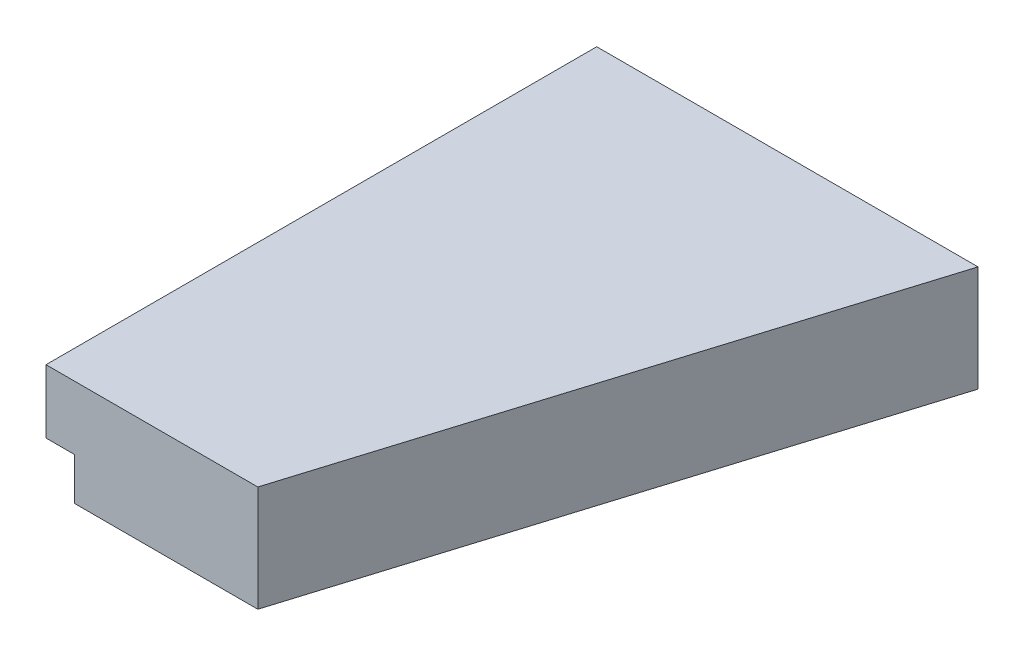
from build123d import *

# Parameters (mm, degrees)
BOSS_EXTRUDE1_DEPTH = 25
BOSS_EXTRUDE2_DEPTH = 10
SKETCH3_W           = 26.114253455
SKETCH3_H           = 3.5
CUT_EXTRUDE1_DEPTH  = 10
CUT_EXTRUDE2_DEPTH  = 0.625
CUT_EXTRUDE3_REACH  = 150.701
SKETCH5_R           = 1.9
SKETCH6_R           = 3.35
CUT_EXTRUDE4_DEPTH  = 2.5
LPATTERN1_COUNT     = 2
LPATTERN1_PITCH     = 52.5
SKETCH7_W           = 6.75
SKETCH7_H           = 130
CUT_EXTRUDE5_DEPTH  = 10


with BuildPart() as part:
    # Sketch1 → Boss-Extrude1 (new body)
    with BuildSketch(Plane(origin=(0, 0, 0), x_dir=(-1, 0, 0), z_dir=(0, 1, 0))):
        Polygon((26.563657866, 147.59508075), (-13.436342134, 17.59508075), (76.563657866, 17.59508075), (76.563657866, 147.59508075), align=None)
        Polygon((-1.435210974, 22.59508075), (33.949404411, 137.59508075), (66.563657866, 137.59508075), (66.563657866, 22.59508075), align=None, mode=Mode.SUBTRACT)
    extrude(amount=BOSS_EXTRUDE1_DEPTH)

    # Sketch2 → Boss-Extrude2 (add)
    with BuildSketch(Plane(origin=(0, 25, 0), x_dir=(-1, 0, 0), z_dir=(0, 1, 0))):
        Polygon((26.563657866, 147.59508075), (76.563657866, 147.59508075), (76.563657866, 17.59508075), (-13.436342134, 17.59508075), align=None)
    extrude(amount=-BOSS_EXTRUDE2_DEPTH)

    # Sketch3 → Cut-Extrude1 (cut)
    with BuildSketch(Plane.XZ):
        with Locations((-50.256531139, 142.59508075)):
            Rectangle(SKETCH3_W, SKETCH3_H)
        Polygon((-26.542117093, 136.473878451), (-29.887343624, 135.44457798), (3.585713743, 26.657141537), (6.930940274, 27.686442008), align=None)
    extrude(amount=-CUT_EXTRUDE1_DEPTH, mode=Mode.SUBTRACT)

    # Sketch4 → Cut-Extrude2 (cut)
    with BuildSketch(Plane(origin=(0, 0, 22.59508075), x_dir=(1, 0, 0), z_dir=(0, 1, 0))):
        Polygon((-66.563657866, 5), (-66.563657866, 0), (1.435210974, 0), (2.973672512, 5), align=None)
    extrude(amount=CUT_EXTRUDE2_DEPTH, mode=Mode.SUBTRACT)

    # Sketch5 → Cut-Extrude3 (cut, up to next)
    with BuildSketch(Plane.XY.offset(22.59508075), mode=Mode.PRIVATE) as cut_extrude3_sk1:
        with Locations((-59.313657866, 5.625)):
            Circle(SKETCH5_R)
    cut_extrude3_tool1 = extrude(cut_extrude3_sk1.sketch, amount=-CUT_EXTRUDE3_REACH, mode=Mode.PRIVATE) & part.part
    cut_extrude3 = cut_extrude3_tool1.solids().sort_by_distance((-59.313658, 5.625, 22.595081))[0]
    add(cut_extrude3, mode=Mode.SUBTRACT)

    # Sketch6 → Cut-Extrude4 (cut)
    with BuildSketch(Plane.XY.offset(22.59508075)):
        with Locations((-59.313657866, 5.625)):
            Circle(SKETCH6_R)
    cut_extrude4 = extrude(amount=-CUT_EXTRUDE4_DEPTH, mode=Mode.SUBTRACT)

    # LPattern1: Cut-Extrude3, Cut-Extrude4 ×2
    with Locations(*[(i * LPATTERN1_PITCH, 0, 0) for i in range(1, LPATTERN1_COUNT)]):
        add(cut_extrude3, mode=Mode.SUBTRACT)
        add(cut_extrude4, mode=Mode.SUBTRACT)

    # Sketch7 → Cut-Extrude5 (cut)
    with BuildSketch(Plane.XZ):
        with Locations((-73.188657866, 82.59508075)):
            Rectangle(SKETCH7_W, SKETCH7_H)
    extrude(amount=-CUT_EXTRUDE5_DEPTH, mode=Mode.SUBTRACT)


solid = part.part
